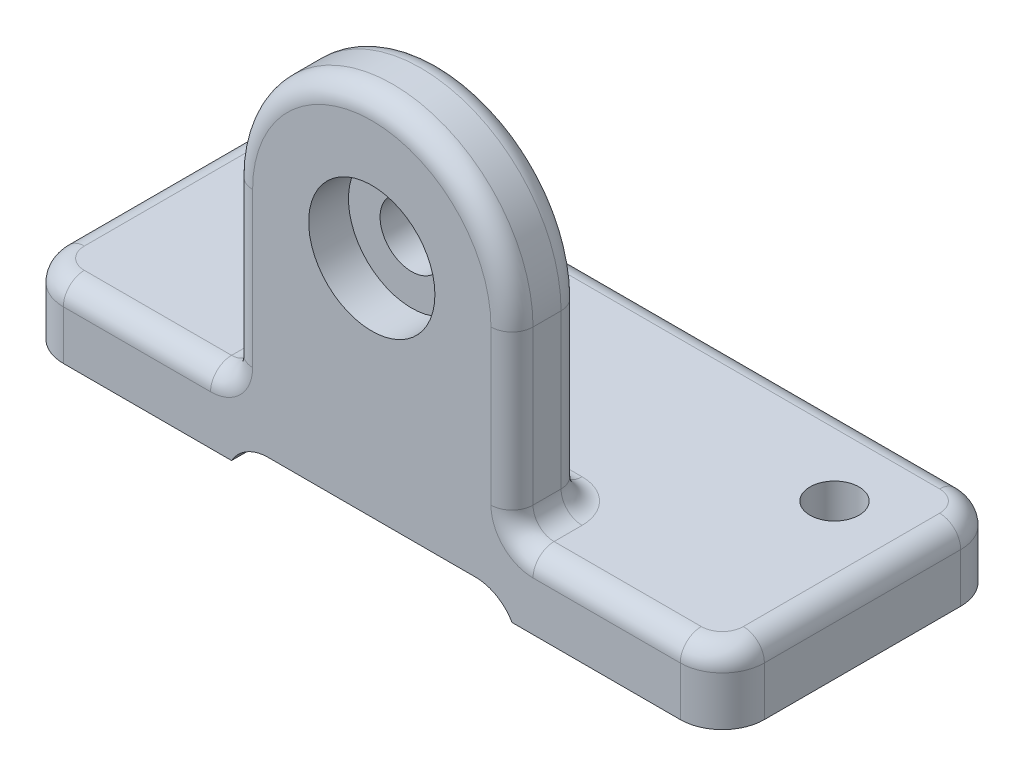
from build123d import *

# Parameters (mm, degrees)
SKETCH1_W                               = 100
SKETCH1_H                               = 40
BASE_PLATE_DEPTH                        = 10
VERT_BOSS_DEPTH                         = 10
SKETCH5_W                               = 40
SKETCH5_H                               = 3
SLOT_DEPTH                              = 121.933866224
HOLE_WIZARD_7_0_7_1_D                   = 7
CBORE_FOR_M8_HEX_HEAD_BOLT1_D           = 9
CBORE_FOR_M8_HEX_HEAD_BOLT1_CBORE_D     = 18.01
CBORE_FOR_M8_HEX_HEAD_BOLT1_CBORE_DEPTH = 5.68
FILLET_1_R                              = 6
FILLET_2_R                              = 3


with BuildPart() as part:
    # Sketch1 → Base Plate (new body)
    with BuildSketch(Plane(origin=(0, 0, 0), x_dir=(1, 0, 0), z_dir=(0, 1, 0))):
        with Locations((50, 20)):
            Rectangle(SKETCH1_W, SKETCH1_H)
    extrude(amount=BASE_PLATE_DEPTH)

    # Sketch2 → Vert Boss (add)
    with BuildSketch(Plane.XY):
        with BuildLine():
            Line((30, 0), (30, 35))
            ThreePointArc((30, 35), (50, 55), (70, 35))
            Line((70, 35), (70, 0))
            Line((70, 0), (30, 0))
        make_face()
    extrude(amount=-VERT_BOSS_DEPTH)

    # Sketch5 → Slot (cut, through all)
    with BuildSketch(Plane.XY):
        with Locations((50, 1.5)):
            Rectangle(SKETCH5_W, SKETCH5_H)
    extrude(amount=-SLOT_DEPTH, mode=Mode.SUBTRACT)

    # Ø7.0 (7) 直徑孔1 (through all)
    with Locations(Plane(origin=(0, 10, 0), x_dir=(-1, 0, 0), z_dir=(0, 1, 0))):
        with Locations((-88, -28), (-12, -28)):
            Hole(HOLE_WIZARD_7_0_7_1_D / 2)

    # CBORE for M8 Hex Head Bolt1 (through all)
    with Locations(Plane.XY):
        with Locations((50, 35)):
            CounterBoreHole(CBORE_FOR_M8_HEX_HEAD_BOLT1_D / 2, CBORE_FOR_M8_HEX_HEAD_BOLT1_CBORE_D / 2, CBORE_FOR_M8_HEX_HEAD_BOLT1_CBORE_DEPTH)

    # 圓角1
    # the kernel refuses this fillet: 6 mm, written as the material it adds along each edge
    with BuildSketch(Plane(origin=(70, 3, 0), x_dir=(-1, 0, 0), z_dir=(0, 0, -1))) as fillet_1_piece_1:
        with BuildLine():
            CenterArc((5.196152423, -6), FILLET_1_R, 90, 60)
            Line((0, -3), (0, 0))
            Line((0, 0), (5.196152423, 0))
        make_face()
    extrude(amount=40)
    with BuildSketch(Plane(origin=(30, 3, 0), x_dir=(0, -1, 0), z_dir=(0, 0, -1))) as fillet_1_piece_2:
        with BuildLine():
            CenterArc((6, -5.196152423), FILLET_1_R, 120, 60)
            Line((0, -5.196152423), (0, 0))
            Line((0, 0), (3, 0))
        make_face()
    extrude(amount=40)
    # the kernel refuses this fillet: 6 mm, written as the material it takes off along each edge
    with BuildSketch(Plane(origin=(0, -15, 0), x_dir=(1, 0, 0), z_dir=(0, 1, 0)), Plane(origin=(0, -15, -40), x_dir=(0, 0, 1), z_dir=(0, 1, 0))) as fillet_1_2_piece_1:
        with BuildLine():
            CenterArc((FILLET_1_R, FILLET_1_R), FILLET_1_R, 180, 90)
            Line((0, FILLET_1_R), (0, 0))
            Line((0, 0), (FILLET_1_R, 0))
        make_face()
    extrude(amount=40, mode=Mode.SUBTRACT)
    with BuildSketch(Plane(origin=(100, -15, -40), x_dir=(0, 0, 1), z_dir=(0, 1, 0)), Plane(origin=(100, -15, 0), x_dir=(-1, 0, 0), z_dir=(0, 1, 0))) as fillet_1_2_piece_2:
        with BuildLine():
            CenterArc((FILLET_1_R, -FILLET_1_R), FILLET_1_R, 90, 90)
            Line((0, -FILLET_1_R), (0, 0))
            Line((0, 0), (FILLET_1_R, 0))
        make_face()
    extrude(amount=40, mode=Mode.SUBTRACT)

    # 圓角2
    fillet_2_edges = [part.edges().sort_by_distance(p)[0] for p in [
        (82, 10, 0),
        (30, 22.5, -10),
        (70, 22.5, -10),
        (30, 22.5, 0),
        (70, 22.5, 0),
        (50, 55, 0),
        (30, 10, -5),
        (50, 55, -10),
        (70, 10, -5),
        (50, 10, -10),
        (18, 10, 0),
        (0, 10, -20),
        (100, 10, -20),
        (50, 10, -40),
        (98.242640687, 10, -1.757359313),
        (98.242640687, 10, -38.242640687),
        (1.757359313, 10, -38.242640687),
        (1.757359313, 10, -1.757359313),
    ]]
    fillet(fillet_2_edges, radius=FILLET_2_R)


solid = part.part
